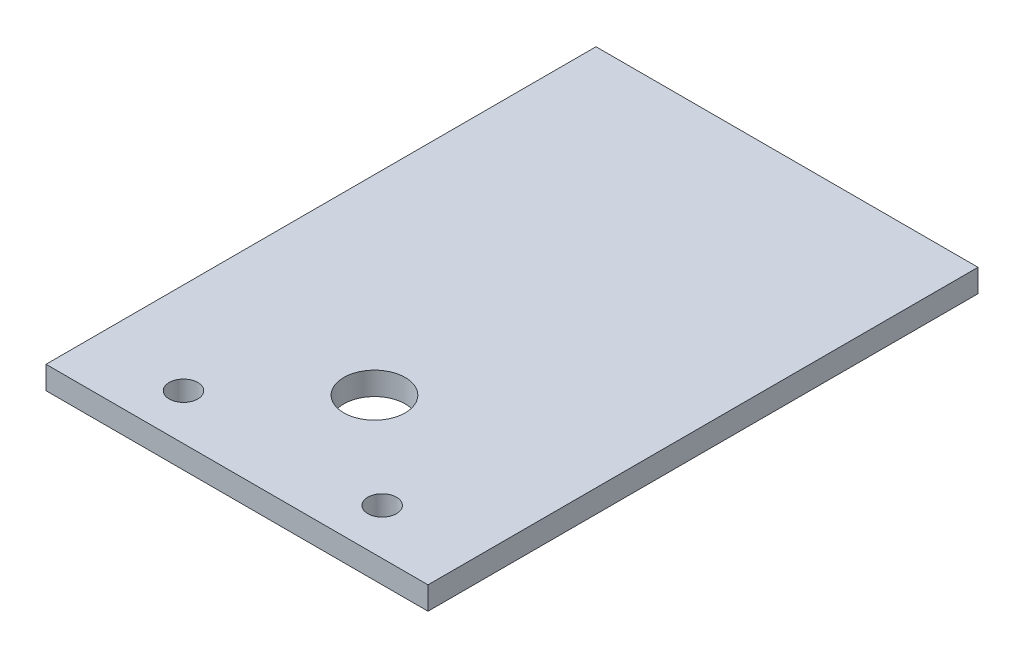
from build123d import *

# Parameters (mm, degrees)
SKETCH1_W           = 105.849999898
SKETCH1_H           = 152.4
BOSS_EXTRUDE1_DEPTH = 6.35
CUT_EXTRUDE1_REACH  = 94.994
SKETCH2_R           = 3.96875
SKETCH2_R_2         = 8.5


with BuildPart() as part:
    # Sketch1 → Boss-Extrude1 (new body)
    with BuildSketch(Plane(origin=(0, 0, 0), x_dir=(1, 0, 0), z_dir=(0, 1, 0))):
        Rectangle(SKETCH1_W, SKETCH1_H)
    extrude(amount=BOSS_EXTRUDE1_DEPTH)

    # Sketch2 → Cut-Extrude1 (cut, up to next)
    with BuildSketch(Plane(origin=(0, 6.35, 0), x_dir=(1, 0, 0), z_dir=(0, 1, 0)), mode=Mode.PRIVATE) as cut_extrude1_sk1:
        with Locations((-27.524999949, -63.5)):
            Circle(SKETCH2_R)
    cut_extrude1_tool1 = extrude(cut_extrude1_sk1.sketch, amount=-CUT_EXTRUDE1_REACH, mode=Mode.PRIVATE) & part.part
    # Sketch2 → Cut-Extrude1 (cut, up to next)
    with BuildSketch(Plane(origin=(0, 6.35, 0), x_dir=(1, 0, 0), z_dir=(0, 1, 0)), mode=Mode.PRIVATE) as cut_extrude1_sk2:
        with Locations((27.524999949, -63.5)):
            Circle(SKETCH2_R)
    cut_extrude1_tool2 = extrude(cut_extrude1_sk2.sketch, amount=-CUT_EXTRUDE1_REACH, mode=Mode.PRIVATE) & part.part
    # Sketch2 → Cut-Extrude1 (cut, up to next)
    with BuildSketch(Plane(origin=(0, 6.35, 0), x_dir=(1, 0, 0), z_dir=(0, 1, 0)), mode=Mode.PRIVATE) as cut_extrude1_sk3:
        with Locations((0, -38.1)):
            Circle(SKETCH2_R_2)
    cut_extrude1_tool3 = extrude(cut_extrude1_sk3.sketch, amount=-CUT_EXTRUDE1_REACH, mode=Mode.PRIVATE) & part.part
    add(cut_extrude1_tool1.solids().sort_by_distance((-27.525, 6.35, 63.5))[0], mode=Mode.SUBTRACT)
    add(cut_extrude1_tool2.solids().sort_by_distance((27.525, 6.35, 63.5))[0], mode=Mode.SUBTRACT)
    add(cut_extrude1_tool3.solids().sort_by_distance((0, 6.35, 38.1))[0], mode=Mode.SUBTRACT)


solid = part.part
